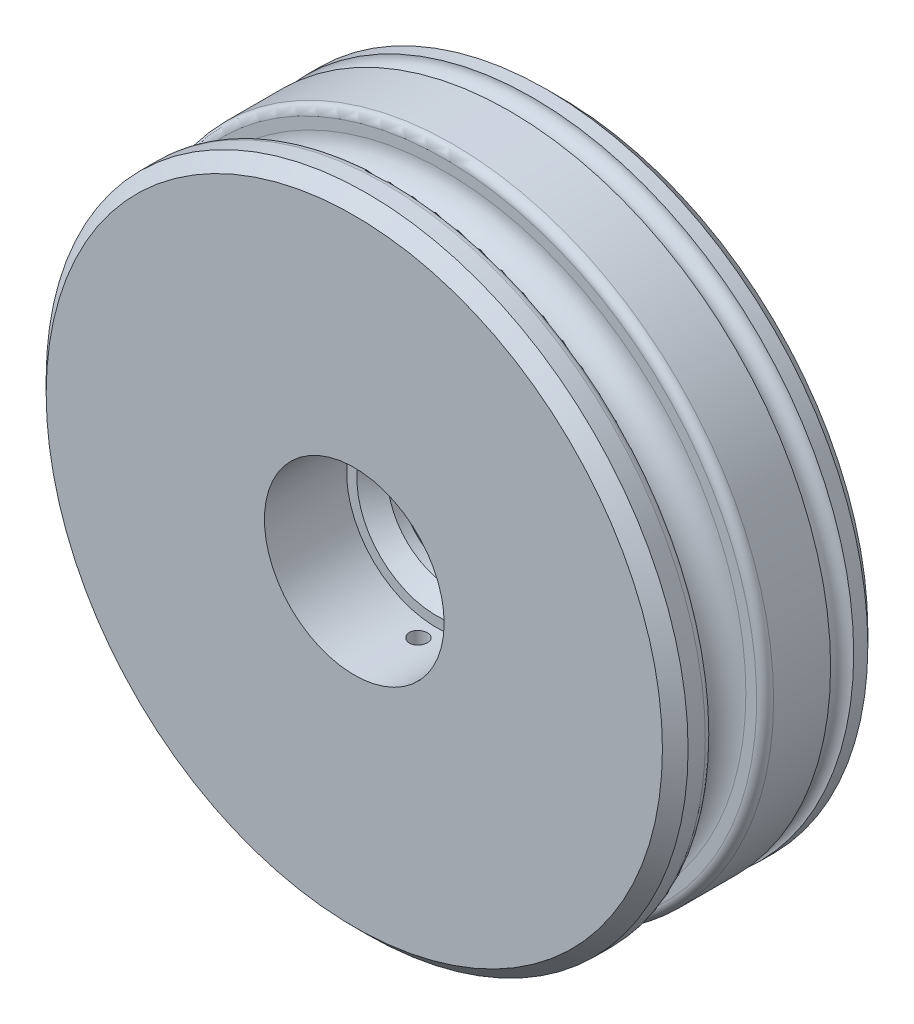
from build123d import *

# Parameters (mm, degrees)
SKETCH1_R                = 12.5
BOSS_EXTRUDE1_DEPTH      = 4
SKETCH2_R                = 3.5
CUT_EXTRUDE1_DEPTH       = 3.2
CHAMFER1_SIZE            = 0.5
SKETCH4_R                = 2.5
CUT_EXTRUDE2_DEPTH       = 18.964965906
CHAMFER2_SIZE            = 0.6
CHAMFER1_OF_MIRROR2_SIZE = 0.5
CHAMFER2_OF_MIRROR2_SIZE = 0.6
SKETCH7_R                = 0.45
FILLET1_R                = 0.33
SKETCH8_R                = 0.35
CUT_EXTRUDE3_DEPTH       = 19.124569098


with BuildPart() as part:
    # Sketch1 → Boss-Extrude1 (new body)
    with BuildSketch(Plane.XY):
        Circle(SKETCH1_R)
    boss_extrude1 = extrude(amount=BOSS_EXTRUDE1_DEPTH)

    # Sketch3 → Cut-Revolve1 (revolve, cut)
    with BuildSketch(Plane(origin=(0, 0, 0), x_dir=(0, 0, -1), z_dir=(1, 0, 0))):
        with BuildLine():
            Line((-2.5, 11.75), (-2.5, 12.75))
            Line((-2.5, 12.75), (-0.5, 12.75))
            Line((-0.5, 12.75), (-0.5, 11.75))
            ThreePointArc((-0.5, 11.75), (-1.5, 10.75), (-2.5, 11.75))
        make_face()
    revolve(axis=Axis((0, 0, -0.35), (0, 0, 1)), mode=Mode.SUBTRACT)

    # Sketch2 → Cut-Extrude1 (cut)
    with BuildSketch(Plane.XY.offset(4)):
        Circle(SKETCH2_R)
    cut_extrude1 = extrude(amount=-CUT_EXTRUDE1_DEPTH, mode=Mode.SUBTRACT)

    # Chamfer1
    chamfer1_edges = [part.edges().sort_by_distance(p)[0] for p in [
        (-12.5, 0, 4),
    ]]
    chamfer(chamfer1_edges, length=CHAMFER1_SIZE)

    # Sketch4 → Cut-Extrude2 (cut, through all)
    with BuildSketch(Plane.XY.offset(0.8)):
        Circle(SKETCH4_R)
    cut_extrude2 = extrude(amount=-CUT_EXTRUDE2_DEPTH, mode=Mode.SUBTRACT)

    # Chamfer2
    chamfer2_edges = [part.edges().sort_by_distance(p)[0] for p in [
        (-2.5, 0, 0.8),
    ]]
    chamfer(chamfer2_edges, length=CHAMFER2_SIZE)

    # Mirror2: Boss-Extrude1, Cut-Extrude1, Cut-Extrude2 across plane
    add(boss_extrude1.mirror(Plane.XY))
    add(cut_extrude1.mirror(Plane.XY), mode=Mode.SUBTRACT)
    add(cut_extrude2.mirror(Plane.XY), mode=Mode.SUBTRACT)

    # Chamfer1 of Mirror2
    chamfer1_of_mirror2_edges = [part.edges().sort_by_distance(p)[0] for p in [
        (-12.5, 0, -4),
    ]]
    chamfer(chamfer1_of_mirror2_edges, length=CHAMFER1_OF_MIRROR2_SIZE)

    # Chamfer2 of Mirror2
    chamfer2_of_mirror2_edges = [part.edges().sort_by_distance(p)[0] for p in [
        (-2.5, 0, -0.8),
    ]]
    chamfer(chamfer2_of_mirror2_edges, length=CHAMFER2_OF_MIRROR2_SIZE)

    # Sketch7 → Cut-Revolve3 (revolve, cut)
    with BuildSketch(Plane(origin=(0, 0, 0), x_dir=(0, 0, -1), z_dir=(1, 0, 0))):
        with Locations((2.5, 12.5)):
            Circle(SKETCH7_R)
    revolve(axis=Axis((0, 0, -0.35), (0, 0, 1)), mode=Mode.SUBTRACT)

    # Fillet1
    fillet1_edges = [part.edges().sort_by_distance(p)[0] for p in [
        (-12.5, 0, 2.5),
        (-12.5, 0, 0.5),
    ]]
    fillet(fillet1_edges, radius=FILLET1_R)

    # Sketch8 → Cut-Extrude3 (cut, through all)
    with BuildSketch(Plane(origin=(0, 0, 0), x_dir=(1, 0, 0), z_dir=(0, 1, 0))):
        with Locations((0, -1.5)):
            Circle(SKETCH8_R)
    extrude(amount=-CUT_EXTRUDE3_DEPTH, mode=Mode.SUBTRACT)


solid = part.part
